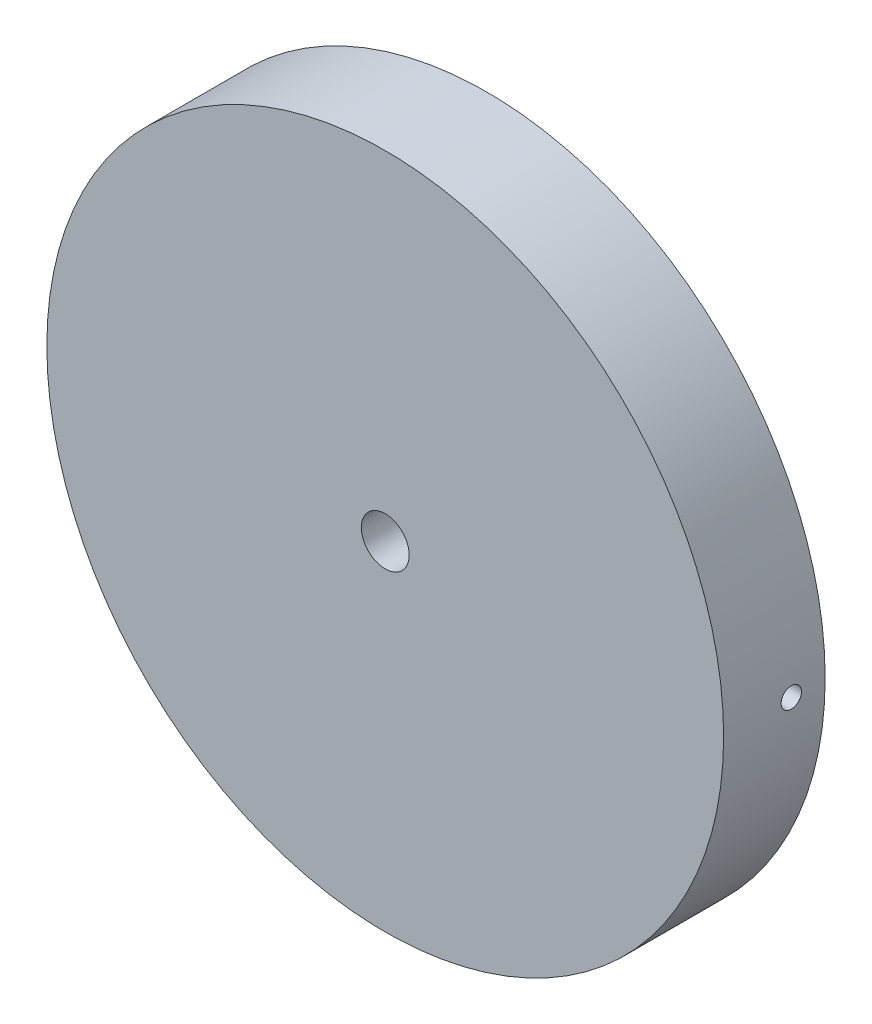
from build123d import *

# Parameters (mm, degrees)
BOSS_EXTRUDE1_DEPTH             = 10
BOSS_EXTRUDE1_DEPTH_BACK        = 5
SKETCH1_R                       = 50
SKETCH1_R_2                     = 3.535
SKETCH2_R                       = 1.5
CUT_EXTRUDE1_DEPTH              = 72.414284285
SKETCH3_R                       = 1.5
CUT_EXTRUDE2_DEPTH              = 72.414284444
BOSS_EXTRUDE2_REACH             = 73.414
SKETCH4_R                       = 35
SKETCH4_R_2                     = 3.535
BOSS_EXTRUDE2_DIRECTION_2_REACH = 73.414


with BuildPart() as part:
    # Sketch1 → Boss-Extrude1 (new, two sides: drawn at the far end of the back side and taken through both)
    with BuildSketch(Plane.XY.offset(-BOSS_EXTRUDE1_DEPTH_BACK)):
        Circle(SKETCH1_R)
        Circle(SKETCH1_R_2, mode=Mode.SUBTRACT)
    extrude(amount=BOSS_EXTRUDE1_DEPTH + BOSS_EXTRUDE1_DEPTH_BACK)

    # Sketch2 → Cut-Extrude1 (cut, through all)
    with BuildSketch(Plane(origin=(0, 0, 0), x_dir=(1, 0, 0), z_dir=(0, 1, 0))):
        Circle(SKETCH2_R)
    extrude(amount=-CUT_EXTRUDE1_DEPTH, mode=Mode.SUBTRACT)

    # Sketch3 → Cut-Extrude2 (cut, through all)
    with BuildSketch(Plane(origin=(0, 0, 0), x_dir=(0, 0, -1), z_dir=(1, 0, 0))):
        Circle(SKETCH3_R)
    extrude(amount=CUT_EXTRUDE2_DEPTH, mode=Mode.SUBTRACT)

    # Boss-Extrude2: up to this face of the body (flat: up to its plane)
    boss_extrude2_end = Plane(part.part.faces().sort_by_distance((-48.585786438, 0, 10))[0])
    # Sketch4 → Boss-Extrude2 (add, up to the picked face)
    with BuildSketch(Plane.XY, mode=Mode.PRIVATE) as boss_extrude2_sk1:
        Circle(SKETCH4_R)
        Circle(SKETCH4_R_2, mode=Mode.SUBTRACT)
    boss_extrude2_tool1 = split(extrude(boss_extrude2_sk1.sketch, amount=BOSS_EXTRUDE2_REACH, mode=Mode.PRIVATE), bisect_by=boss_extrude2_end, keep=Keep.BOTH, mode=Mode.PRIVATE)
    add(boss_extrude2_tool1.solids().sort_by(Axis((-34.010051, 0, 0), (0, 0, 1)))[0])

    # Boss-Extrude2 direction 2: up to this face of the body (flat: up to its plane)
    boss_extrude2_direction_2_end = Plane(part.part.faces().sort_by_distance((-48.585786438, 0, -5))[0])
    # Sketch4 → Boss-Extrude2 direction 2 (add, up to the picked face)
    with BuildSketch(Plane.XY, mode=Mode.PRIVATE) as boss_extrude2_direction_2_sk1:
        Circle(SKETCH4_R)
        Circle(SKETCH4_R_2, mode=Mode.SUBTRACT)
    boss_extrude2_direction_2_tool1 = split(extrude(boss_extrude2_direction_2_sk1.sketch, amount=-BOSS_EXTRUDE2_DIRECTION_2_REACH, mode=Mode.PRIVATE), bisect_by=boss_extrude2_direction_2_end, keep=Keep.BOTH, mode=Mode.PRIVATE)
    add(boss_extrude2_direction_2_tool1.solids().sort_by(Axis((-34.010051, 0, 0), (0, 0, -1)))[0])


solid = part.part
